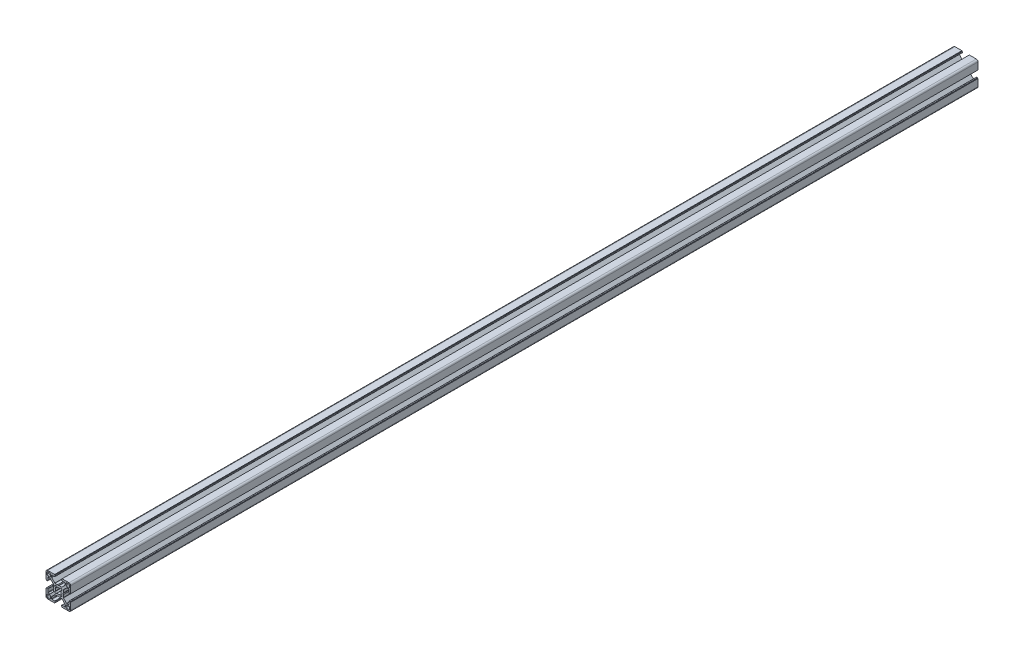
from build123d import *

# Parameters (mm, degrees)
BOSS_EXTRUDE1_DEPTH = 550
CIRPATTERN1_COUNT   = 4


with BuildPart() as part:
    # Sketch3 → Boss-Extrude1 (new, symmetric)
    with BuildSketch(Plane.XY):
        with BuildLine():
            Line((-4.503841895, 3.156803476), (-3.14772708, 1.530298739))
            ThreePointArc((-3.14772708, 1.530298739), (-3.410794979, 0.785160882), (-3.5, 0))
            Line((-3.5, 0), (-5.5, 0))
            Line((-5.5, 0), (-6, 0.866025404))
            Line((-6, 0.866025404), (-6, 3.996841995))
            ThreePointArc((-6, 3.996841995), (-6.038060234, 4.188183711), (-6.146446609, 4.350395385))
            Line((-6.146446609, 4.350395385), (-9.917104615, 8.121053391))
            ThreePointArc((-9.917104615, 8.121053391), (-10.079316289, 8.229439766), (-10.270658005, 8.2675))
            Line((-10.270658005, 8.2675), (-12.29, 8.2675))
            ThreePointArc((-12.29, 8.2675), (-12.643553391, 8.121053391), (-12.79, 7.7675))
            Line((-12.79, 7.7675), (-12.79, 4.5))
            ThreePointArc((-12.79, 4.5), (-12.936446609, 4.146446609), (-13.29, 4))
            Line((-13.29, 4), (-14.5, 4))
            Line((-14.5, 4), (-14.5, 4.5))
            Line((-14.5, 4.5), (-15, 4.5))
            Line((-15, 4.5), (-15, 12.968))
            ThreePointArc((-15, 12.968), (-14.404840979, 14.404840979), (-12.968, 15))
            Line((-12.968, 15), (-4.5, 15))
            Line((-4.5, 15), (-4.5, 14.5))
            Line((-4.5, 14.5), (-4, 14.5))
            Line((-4, 14.5), (-4, 13.29))
            ThreePointArc((-4, 13.29), (-4.146446609, 12.936446609), (-4.5, 12.79))
            Line((-4.5, 12.79), (-7.7675, 12.79))
            ThreePointArc((-7.7675, 12.79), (-8.121053391, 12.643553391), (-8.2675, 12.29))
            Line((-8.2675, 12.29), (-8.2675, 10.270658005))
            ThreePointArc((-8.2675, 10.270658005), (-8.229439766, 10.079316289), (-8.121053391, 9.917104615))
            Line((-8.121053391, 9.917104615), (-4.350395385, 6.146446609))
            ThreePointArc((-4.350395385, 6.146446609), (-4.188183711, 6.038060234), (-3.996841995, 6))
            Line((-3.996841995, 6), (-0.866025404, 6))
            Line((-0.866025404, 6), (0, 5.5))
            Line((0, 5.5), (0, 3.5))
            ThreePointArc((0, 3.5), (-0.785160882, 3.410794979), (-1.530298739, 3.14772708))
            Line((-1.530298739, 3.14772708), (-3.156803476, 4.503841895))
            ThreePointArc((-3.156803476, 4.503841895), (-3.889087297, 3.889087297), (-4.503841895, 3.156803476))
        make_face()
        with BuildLine():
            Line((-12.705, 9.5135), (-10.5135, 9.5135))
            ThreePointArc((-10.5135, 9.5135), (-9.806393219, 9.806393219), (-9.5135, 10.5135))
            Line((-9.5135, 10.5135), (-9.5135, 12.705))
            ThreePointArc((-9.5135, 12.705), (-9.806393219, 13.412106781), (-10.5135, 13.705))
            Line((-10.5135, 13.705), (-12.705, 13.705))
            ThreePointArc((-12.705, 13.705), (-13.412106781, 13.412106781), (-13.705, 12.705))
            Line((-13.705, 12.705), (-13.705, 10.5135))
            ThreePointArc((-13.705, 10.5135), (-13.412106781, 9.806393219), (-12.705, 9.5135))
        make_face(mode=Mode.SUBTRACT)
    boss_extrude1 = extrude(amount=BOSS_EXTRUDE1_DEPTH, both=True)

    # CirPattern1: Boss-Extrude1 ×4 about axis
    cirpattern1_axis = Axis((0, 0, 76.2), (0, 0, -1))
    for i in range(1, CIRPATTERN1_COUNT):
        add(boss_extrude1.rotate(cirpattern1_axis, i * 360 / CIRPATTERN1_COUNT))


solid = part.part
